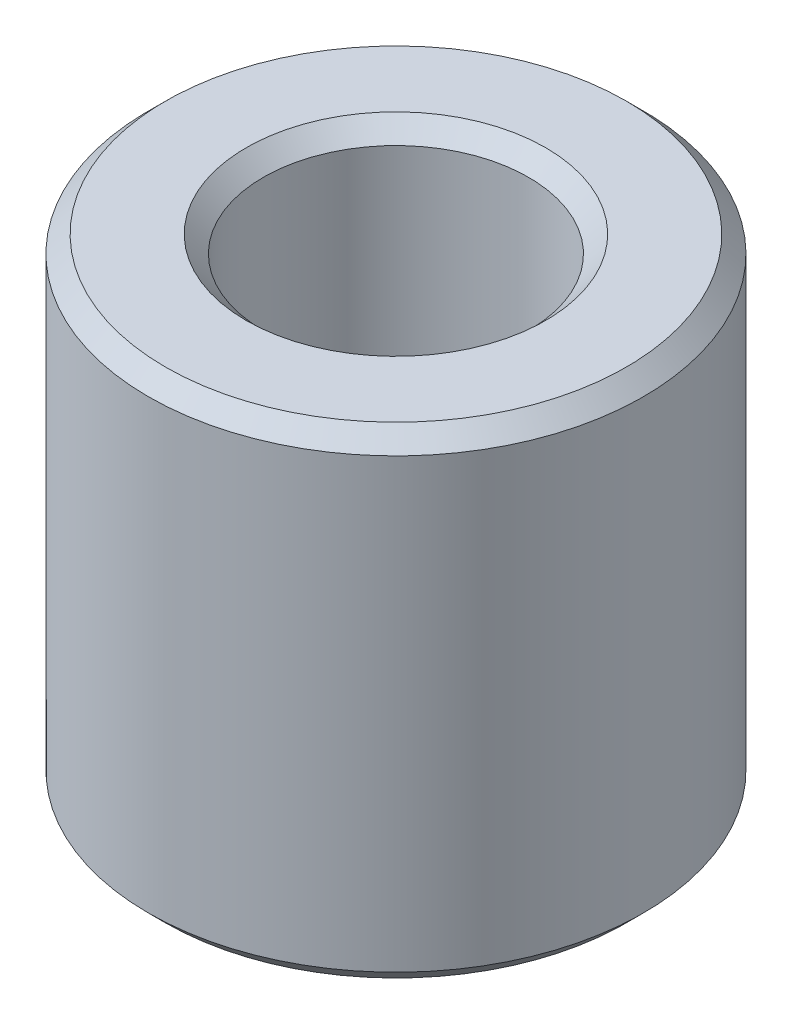
from build123d import *

# Parameters (mm, degrees)
SKETCH1_R           = 50
BOSS_EXTRUDE1_DEPTH = 97.238282684
SKETCH2_R           = 26.794296705
CUT_EXTRUDE1_DEPTH  = 121.230127752
CHAMFER1_SIZE       = 3.453331922


with BuildPart() as part:
    # Sketch1 → Boss-Extrude1 (new body)
    with BuildSketch(Plane(origin=(0, 0, 0), x_dir=(1, 0, 0), z_dir=(0, 1, 0))):
        Circle(SKETCH1_R)
    extrude(amount=BOSS_EXTRUDE1_DEPTH)

    # Sketch2 → Cut-Extrude1 (cut, through all)
    with BuildSketch(Plane(origin=(0, 0, 0), x_dir=(1, 0, 0), z_dir=(0, 1, 0))):
        Circle(SKETCH2_R)
    extrude(amount=CUT_EXTRUDE1_DEPTH, mode=Mode.SUBTRACT)

    # Chamfer1
    chamfer1_edges = [part.edges().sort_by_distance(p)[0] for p in [
        (-26.794296705, 97.238282684, 0),
        (-26.794296705, 0, 0),
        (-50, 0, 0),
        (-50, 97.238282684, 0),
    ]]
    chamfer(chamfer1_edges, length=CHAMFER1_SIZE)


solid = part.part
